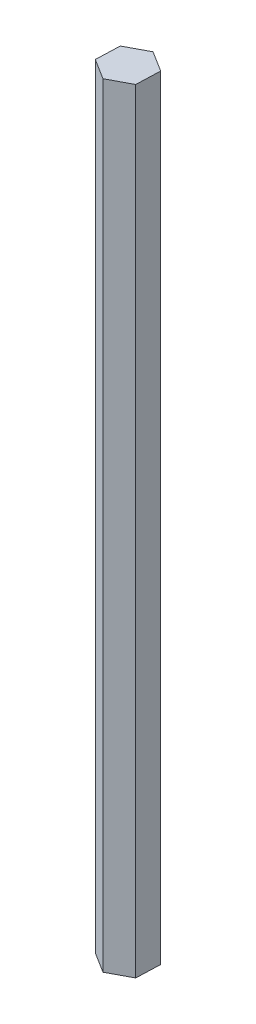
from build123d import *

# Parameters (mm, degrees)
EXTRUDE_1_DEPTH = 120


with BuildPart() as part:
    # Эскиз1 → Бобышка-Вытянуть1 (new body)
    with BuildSketch(Plane(origin=(0, 0, 0), x_dir=(1, 0, 0), z_dir=(0, 1, 0))):
        Polygon((3.1789955, -1.989092157), (3.312102088, 1.758544784), (0.133106588, 3.74763694), (-3.1789955, 1.989092157), (-3.312102088, -1.758544784), (-0.133106588, -3.74763694), align=None)
    extrude(amount=EXTRUDE_1_DEPTH)


solid = part.part
